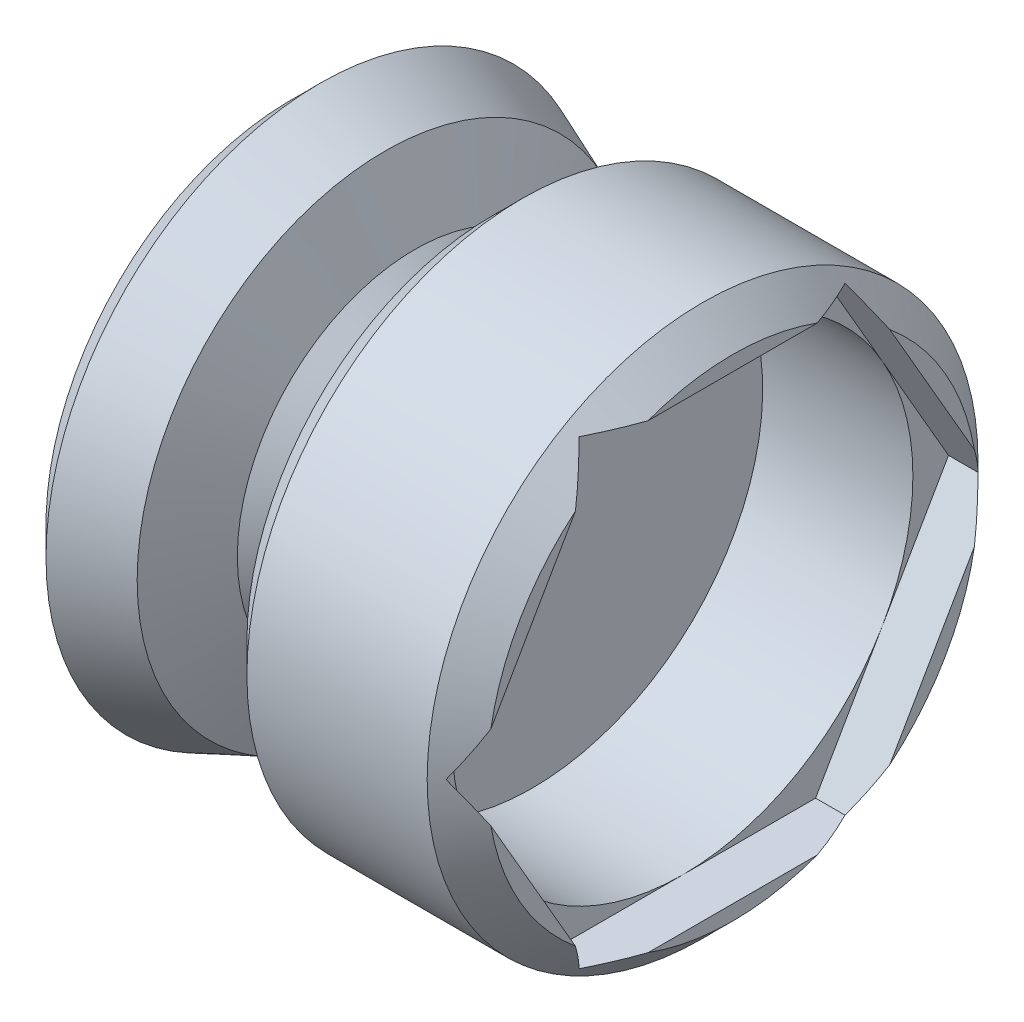
from build123d import *

# Parameters (mm, degrees)
SKETCH1_R           = 13.75
BOSS_EXTRUDE1_DEPTH = 22.03
SKETCH3_W           = 3.5
SKETCH3_H           = 3.5
CUT_EXTRUDE1_DEPTH  = 3.75
CUT_EXTRUDE2_START  = -12
CUT_EXTRUDE2_DEPTH  = 2.5
CUT_EXTRUDE4_START  = -9.5
SKETCH4_29_R        = 11.5
CUT_EXTRUDE4_DEPTH  = 7.5
CUT_EXTRUDE5_START  = -2
SKETCH4_30_R        = 1.25
CUT_EXTRUDE5_DEPTH  = 2
CHAMFER1_SIZE       = 1.5
CHAMFER2_SIZE       = 1.5
CHAMFER2_SIZE_2     = 2.841585372


# Read off the part's stored shape, not the designer's step: Cut-Revolve-Thin1
with BuildPart() as part:
    # Sketch1 → Boss-Extrude1 (new body)
    with BuildSketch(Plane(origin=(0, 0, 0), x_dir=(0, 0, -1), z_dir=(1, 0, 0))):
        Circle(SKETCH1_R)
    extrude(amount=BOSS_EXTRUDE1_DEPTH)

    # Sketch2 → Cut-Revolve1 (revolve, cut)
    with BuildSketch(Plane(origin=(46.159172163, 0, 11.54266395), x_dir=(0, 0, 1), z_dir=(0, 1, 0)), mode=Mode.PRIVATE) as cut_revolve1_sk:
        with BuildLine():
            Line((-22.29266395, -43.379172163), (-21.047307804, -43.379172163))
            Line((-21.047307804, -43.379172163), (-21.047307804, -42.629172163))
            ThreePointArc((-21.047307804, -42.629172163), (-20.923021734, -42.215672371), (-20.591355596, -41.939218617))
            Line((-20.591355596, -41.939218617), (-15.75766395, -39.879172163))
            Line((-15.75766395, -39.879172163), (-11.54266395, -39.879172163))
            Line((-11.54266395, -39.879172163), (-11.54266395, -46.159172163))
            Line((-11.54266395, -46.159172163), (-23.04266395, -46.159172163))
            Line((-23.04266395, -46.159172163), (-23.04266395, -44.129172163))
            ThreePointArc((-23.04266395, -44.129172163), (-22.822994036, -43.598842077), (-22.29266395, -43.379172163))
        make_face()
    revolve(cut_revolve1_sk.sketch.rotate(Axis((-993.090827837, 0, 0), (1, 0, 0)), 180), axis=Axis((-993.090827837, 0, 0), (1, 0, 0)), mode=Mode.SUBTRACT)

    # Sketch3 → Cut-Extrude1 (cut)
    with BuildSketch(Plane.ZY.offset(-6.28)):
        Rectangle(SKETCH3_W, SKETCH3_H)
    extrude(amount=-CUT_EXTRUDE1_DEPTH, mode=Mode.SUBTRACT)

    # Sketch4 → Cut-Extrude2 (cut)
    with BuildSketch(Plane(origin=(10.03, 32, 0), x_dir=(0, 0, 1), z_dir=(-1, 0, 0)).offset(CUT_EXTRUDE2_START)):
        Polygon((-6.639528096, -20.5), (-13.279056191, -32), (-6.639528096, -43.5), (6.639528096, -43.5), (13.279056191, -32), (6.639528096, -20.5), align=None)
    extrude(amount=CUT_EXTRUDE2_DEPTH, mode=Mode.SUBTRACT)

    # Sketch4<29> → Cut-Extrude4 (cut)
    with BuildSketch(Plane(origin=(10.03, 32, 0), x_dir=(0, 0, 1), z_dir=(-1, 0, 0)).offset(CUT_EXTRUDE4_START)):
        with Locations((0, -32)):
            Circle(SKETCH4_29_R)
    extrude(amount=CUT_EXTRUDE4_DEPTH, mode=Mode.SUBTRACT)

    # Sketch4<30> → Cut-Extrude5 (cut)
    with BuildSketch(Plane(origin=(10.03, 32, 0), x_dir=(0, 0, 1), z_dir=(-1, 0, 0)).offset(CUT_EXTRUDE5_START)):
        with Locations((0, -32)):
            Circle(SKETCH4_30_R)
    extrude(amount=CUT_EXTRUDE5_DEPTH, mode=Mode.SUBTRACT)

    # Cut-Revolve-Thin1 outline → Cut-Revolve-Thin1 (revolve, cut)
    with BuildSketch(Plane.YX):
        Polygon((13.75, 10.03), (6.25, 10.03), (6.25, 7.28), (13.75, 4.083613153), align=None)
    revolve(axis=Axis((0, 0, 0), (1, 0, 0)), mode=Mode.SUBTRACT)

    # Chamfer1
    # the kernel refuses this chamfer: 1.5 mm, written as the material it adds along each edge
    with BuildSketch(Plane(origin=(10.03, 0, 0), x_dir=(0, 1, 0), z_dir=(0, 0, -1))) as chamfer1_piece_1:
        Polygon((6.25, -CHAMFER1_SIZE), (6.25 + CHAMFER1_SIZE, 0), (6.25, 0), align=None)
    revolve(axis=Axis((10.03, 0, 0), (1, 0, 0)))
    # the kernel refuses this chamfer: 1.5 mm, written as the material it takes off along each edge
    with BuildSketch(Plane(origin=(0, 0, 0), x_dir=(0, 0, -1), z_dir=(0, -1, 0))) as chamfer1_2_piece_1:
        Polygon((13.75, CHAMFER1_SIZE), (13.75 - CHAMFER1_SIZE, 0), (13.75, 0), align=None)
    revolve(axis=Axis((0, 0, 0), (1, 0, 0)), mode=Mode.SUBTRACT)
    with BuildSketch(Plane(origin=(22.03, 0, 0), x_dir=(0, 0, -1), z_dir=(0, -1, 0))) as chamfer1_2_piece_2:
        Polygon((13.75, -CHAMFER1_SIZE), (13.75 - CHAMFER1_SIZE, 0), (13.75, 0), align=None)
    revolve(axis=Axis((22.03, 0, 0), (1, 0, 0)), mode=Mode.SUBTRACT)
    with BuildSketch(Plane(origin=(10.03, 0, 0), x_dir=(0, 0, -1), z_dir=(0, 1, 0))) as chamfer1_2_piece_3:
        Polygon((13.75 - CHAMFER1_SIZE, 0), (13.75, -CHAMFER1_SIZE), (13.75, 0), align=None)
    revolve(axis=Axis((10.03, 0, 0), (-1, 0, 0)), mode=Mode.SUBTRACT)

    # Chamfer2
    # the kernel refuses this chamfer: 2.841585372, 1.5 mm, written as the material it adds along each edge
    with BuildSketch(Plane(origin=(7.28, 0, 0), x_dir=(0, 1, 0), z_dir=(0, 0, -1))) as chamfer2_piece_1:
        Polygon((6.25, CHAMFER2_SIZE), (6.25 + CHAMFER2_SIZE_2 * 0.919938061778, -CHAMFER2_SIZE_2 * 0.392063722763), (6.25, 0), align=None)
    revolve(axis=Axis((7.28, 0, 0), (1, 0, 0)))
    # the kernel refuses this chamfer: 2.841585372, 1.5 mm, written as the material it takes off along each edge
    with BuildSketch(Plane(origin=(4.083613153, 0, 0), x_dir=(0, 1, 0), z_dir=(0, 0, -1))) as chamfer2_2_piece_1:
        Polygon((13.75 - CHAMFER2_SIZE * 0.919938061679, CHAMFER2_SIZE * 0.392063722721), (13.75, -CHAMFER2_SIZE_2), (13.75, 0), align=None)
    revolve(axis=Axis((4.083613153, 0, 0), (1, 0, 0)), revolution_arc=270, mode=Mode.SUBTRACT)
    with BuildSketch(Plane(origin=(4.083613153, 0, 0), x_dir=(0, 0, -1), z_dir=(0, -1, 0))) as chamfer2_2_piece_2:
        Polygon((13.75 - CHAMFER2_SIZE * 0.919938061679, CHAMFER2_SIZE * 0.392063722721), (13.75, -CHAMFER2_SIZE_2), (13.75, 0), align=None)
    revolve(axis=Axis((4.083613153, 0, 0), (1, 0, 0)), revolution_arc=90, mode=Mode.SUBTRACT)


solid = part.part
